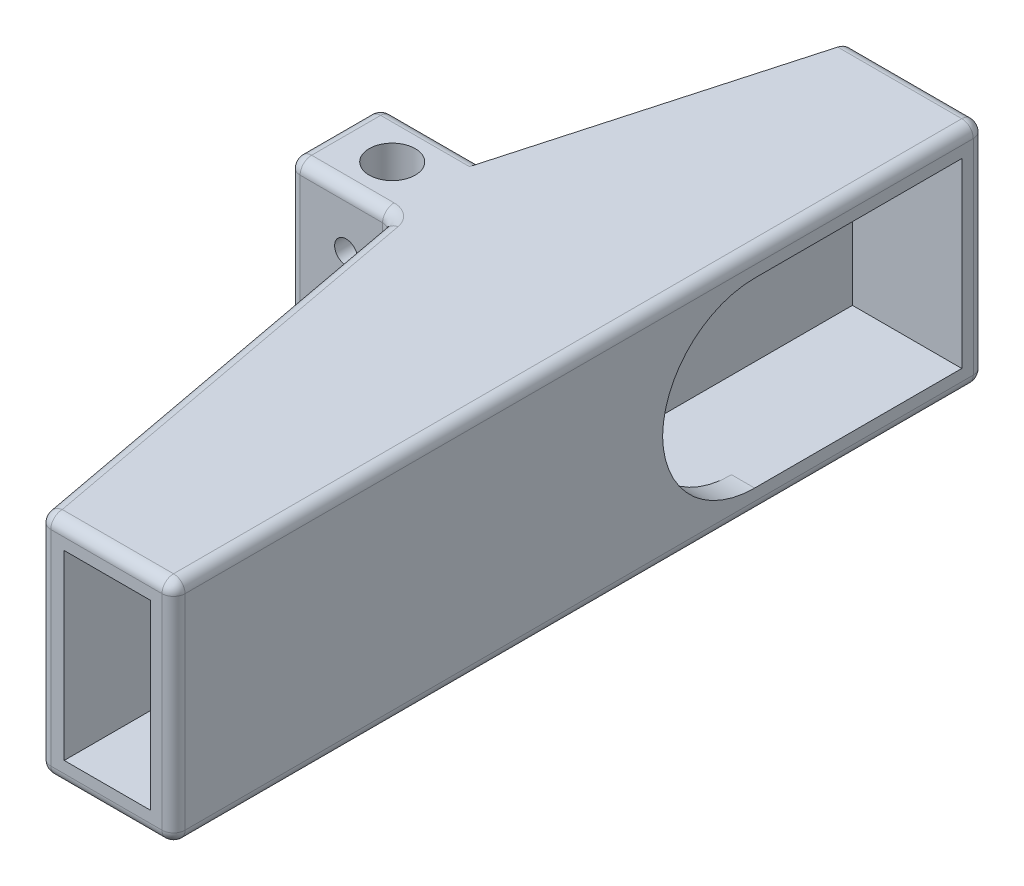
from build123d import *

# Parameters (mm, degrees)
CROQUIS1_W                 = 19.8
CROQUIS1_H                 = 11.5
SALIENTE_EXTRUIR1_DEPTH    = 70.5
VACIADO1_T                 = -2
CROQUIS5_W                 = 15.8
CROQUIS5_H                 = 2
SALIENTE_EXTRUIR2_DEPTH    = 2
CROQUIS6_W                 = 19.8
CROQUIS6_H                 = 8
SALIENTE_EXTRUIR4_DEPTH    = 16
SALIENTE_EXTRUIR5_DEPTH    = 19.8
CROQUIS10_R                = 2
CORTAR_EXTRUIR4_DEPTH      = 19.8
CORTAR_EXTRUIR3_DEPTH      = 43.653516854
CORTAR_EXTRUIR3_DEPTH_BACK = 43.653516854
CROQUIS8_R                 = 1
CROQUIS11_W                = 15.8
CROQUIS11_H                = 26
CORTAR_EXTRUIR5_DEPTH      = 2
REDONDEO2_R                = 8
REDONDEO4_R                = 1
REDONDEO5_R                = 1
REDONDEO6_R                = 1
REDONDEO7_R                = 1
REDONDEO8_R                = 1


with BuildPart() as part:
    # Croquis1 → Saliente-Extruir1 (new body)
    with BuildSketch(Plane(origin=(0, 0, 0), x_dir=(0, 1, 0), z_dir=(0, 0, 1))):
        Rectangle(CROQUIS1_W, CROQUIS1_H)
    extrude(amount=SALIENTE_EXTRUIR1_DEPTH)

    # Vaciado1
    vaciado1_openings = [part.faces().sort_by_distance(p)[0] for p in [
        (0, 0, 70.5),
    ]]
    offset(amount=VACIADO1_T, openings=vaciado1_openings, kind=Kind.INTERSECTION)

    # Croquis5 → Saliente-Extruir2 (add)
    with BuildSketch(Plane.YZ.offset(5.75)):
        with Locations((0, 69.5)):
            Rectangle(CROQUIS5_W, CROQUIS5_H)
    extrude(amount=-SALIENTE_EXTRUIR2_DEPTH)

    # Croquis6 → Saliente-Extruir4 (add)
    with BuildSketch(Plane(origin=(-5.75, 0, 0), x_dir=(0, -1, 0), z_dir=(-1, 0, 0))):
        with Locations((0, 29)):
            Rectangle(CROQUIS6_W, CROQUIS6_H)
    extrude(amount=SALIENTE_EXTRUIR4_DEPTH)

    # Croquis9 → Saliente-Extruir5 (add)
    with BuildSketch(Plane.XZ.offset(9.9)):
        Polygon((-5.75, 70.5), (-12.75, 33), (-5.75, 33), align=None)
        Polygon((-5.75, 0), (-12.75, 25), (-5.75, 25), align=None)
    extrude(amount=-SALIENTE_EXTRUIR5_DEPTH)

    # Croquis10 → Cortar-Extruir4 (cut)
    with BuildSketch(Plane.XZ.offset(9.9)):
        with Locations(Location((-16.745253682, 29, 0), (0, 0, 270))):
            Circle(CROQUIS10_R)
    extrude(amount=-CORTAR_EXTRUIR4_DEPTH, mode=Mode.SUBTRACT)

    # Croquis8 → Cortar-Extruir3 (cut, two sides: drawn at the far end of the back side and taken through both)
    with BuildSketch(Plane(origin=(-4, 0, 33), x_dir=(1, 0, 0), z_dir=(0, 0, 1)).offset(-CORTAR_EXTRUIR3_DEPTH_BACK)):
        with Locations((-12.75, 5.1)):
            Circle(CROQUIS8_R)
        with Locations((-12.75, -4.9)):
            Circle(CROQUIS8_R)
    extrude(amount=CORTAR_EXTRUIR3_DEPTH + CORTAR_EXTRUIR3_DEPTH_BACK, mode=Mode.SUBTRACT)

    # Croquis11 → Cortar-Extruir5 (cut)
    with BuildSketch(Plane.YZ.offset(5.75)):
        with Locations((0, 15)):
            Rectangle(CROQUIS11_W, CROQUIS11_H)
    extrude(amount=-CORTAR_EXTRUIR5_DEPTH, mode=Mode.SUBTRACT)

    # Redondeo2
    # the kernel refuses this fillet: 8 mm, written as the material it adds along each edge
    with BuildSketch(Plane(origin=(5.75, -7.9, 28), x_dir=(0, 1, 0), z_dir=(-1, 0, 0)), Plane(origin=(5.75, 7.9, 28), x_dir=(0, 0, -1), z_dir=(-1, 0, 0))) as redondeo2_piece_1:
        with BuildLine():
            CenterArc((REDONDEO2_R, REDONDEO2_R), REDONDEO2_R, 180, 90)
            Line((0, REDONDEO2_R), (0, 0))
            Line((0, 0), (REDONDEO2_R, 0))
        make_face()
    extrude(amount=2)

    # Redondeo4
    redondeo4_edges = [part.edges().sort_by_distance(p)[0] for p in [
        (-12.75, 0, 33),
    ]]
    fillet(redondeo4_edges, radius=REDONDEO4_R)

    # Redondeo5
    redondeo5_edges = [part.edges().sort_by_distance(p)[0] for p in [
        (5.75, 0, 70.5),
        (-5.75, 0, 70.5),
    ]]
    fillet(redondeo5_edges, radius=REDONDEO5_R)

    # Redondeo6
    redondeo6_edges = [part.edges().sort_by_distance(p)[0] for p in [
        (-12.941660805, -9.9, 33.230748054),
        (-12.941660805, 9.9, 33.230748054),
        (-9.25, 9.9, 51.75),
        (-9.25, -9.9, 51.75),
        (-0.084696812, 9.9, 70.5),
        (5.75, 9.9, 34.75),
        (5.457106781, 9.9, 70.207106781),
        (-5.558339195, 9.9, 70.269251946),
        (-0.084696812, -9.9, 70.5),
        (5.75, -9.9, 34.75),
        (5.457106781, -9.9, 70.207106781),
        (-5.558339195, -9.9, 70.269251946),
        (-17.665303188, 9.9, 33),
        (-17.665303188, -9.9, 33),
    ]]
    fillet(redondeo6_edges, radius=REDONDEO6_R)

    # Redondeo7
    redondeo7_edges = [part.edges().sort_by_distance(p)[0] for p in [
        (-0.5, 9.9, 0),
        (5.75, 0, 0),
        (-0.5, -9.9, 0),
        (5.457106781, -9.607106781, 0),
        (5.457106781, 9.607106781, 0),
        (-21.75, 0, 25),
    ]]
    fillet(redondeo7_edges, radius=REDONDEO7_R)

    # Redondeo8
    redondeo8_edges = [part.edges().sort_by_distance(p)[0] for p in [
        (-21.75, 9.9, 29),
        (-21.75, 0, 33),
        (-21.75, -9.607106781, 32.707106781),
        (-21.75, 9.607106781, 32.707106781),
        (-21.75, -9.9, 29),
        (-16.75, -9.9, 25),
        (-21.457106781, -9.9, 25.292893219),
        (-16.75, 9.9, 25),
        (-21.457106781, 9.9, 25.292893219),
    ]]
    fillet(redondeo8_edges, radius=REDONDEO8_R)


solid = part.part
